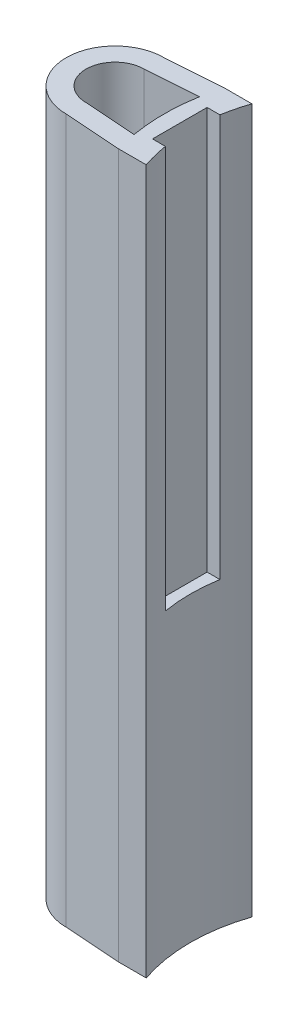
from build123d import *

# Parameters (mm, degrees)
BOSS_EXTRUDE1_DEPTH = 40
CUT_EXTRUDE1_START  = -22.857142857
CUT_EXTRUDE1_DEPTH  = 22.857142857


with BuildPart() as part:
    # Sketch2 → Boss-Extrude1 (new body)
    with BuildSketch(Plane(origin=(0, 0, 0), x_dir=(1, 0, 0), z_dir=(0, 1, 0))):
        with BuildLine():
            Line((0, 2.775), (3.1979918, 3))
            Line((3.1979918, 3), (4.769352085, 3))
            ThreePointArc((4.769352085, 3), (4.275, 0), (4.769352085, -3))
            Line((4.769352085, -3), (3.1979918, -3))
            Line((3.1979918, -3), (0, -2.775))
            ThreePointArc((0, -2.775), (-2.775, 0), (0, 2.775))
        make_face()
        with BuildLine():
            Line((0, 1.65), (2.935008537, 1.856497378))
            ThreePointArc((2.935008537, 1.856497378), (2.775, 0), (2.935008537, -1.856497378))
            Line((2.935008537, -1.856497378), (0, -1.65))
            ThreePointArc((0, -1.65), (-1.65, 0), (0, 1.65))
        make_face(mode=Mode.SUBTRACT)
    extrude(amount=BOSS_EXTRUDE1_DEPTH)

    # Sketch3 → Cut-Extrude1 (cut)
    with BuildSketch(Plane(origin=(0, 40, 0), x_dir=(1, 0, 0), z_dir=(0, 1, 0)).offset(CUT_EXTRUDE1_START)):
        with BuildLine():
            Line((3.675, 1.55), (4.404370954, 1.55))
            ThreePointArc((4.404370954, 1.55), (4.275, 0), (4.404370954, -1.55))
            Line((4.404370954, -1.55), (3.675, -1.55))
            Line((3.675, -1.55), (3.675, 1.55))
        make_face()
    extrude(amount=CUT_EXTRUDE1_DEPTH, mode=Mode.SUBTRACT)


solid = part.part
